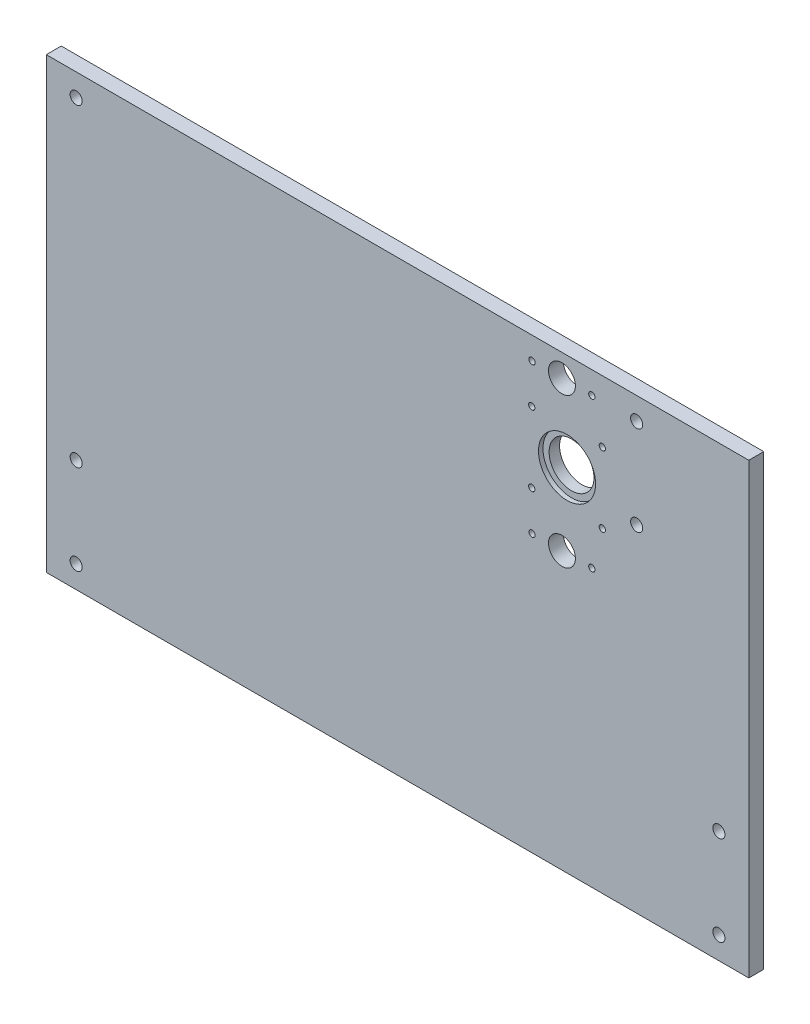
from build123d import *

# Parameters (mm, degrees)
SKETCH2_W           = 470
SKETCH2_H           = 300
BOSS_EXTRUDE1_DEPTH = 5
SKETCH3_R           = 4.05
CUT_EXTRUDE1_DEPTH  = 10
SKETCH4_R           = 9
SKETCH4_R_2         = 2.1
CUT_EXTRUDE2_DEPTH  = 279.971324691
SKETCH5_R           = 4.05
CUT_EXTRUDE3_DEPTH  = 279.971324691
SKETCH6_R           = 4.05
CUT_EXTRUDE4_DEPTH  = 279.971324691
SKETCH7_R           = 19.1
CUT_EXTRUDE5_DEPTH  = 3
SKETCH8_R           = 15
CUT_EXTRUDE6_DEPTH  = 279.879902467
SKETCH9_R           = 2.1
CUT_EXTRUDE7_DEPTH  = 279.971324691


with BuildPart() as part:
    # Sketch2 → Boss-Extrude1 (new, symmetric)
    with BuildSketch(Plane.XY):
        Rectangle(SKETCH2_W, SKETCH2_H)
    extrude(amount=BOSS_EXTRUDE1_DEPTH, both=True)

    # Sketch3 → Cut-Extrude1 (cut)
    with BuildSketch(Plane.XY.offset(5)):
        with Locations((-215, -75)):
            Circle(SKETCH3_R)
        with Locations((-215, -135)):
            Circle(SKETCH3_R)
        with Locations((215, -75)):
            Circle(SKETCH3_R)
        with Locations((215, -135)):
            Circle(SKETCH3_R)
    extrude(amount=-CUT_EXTRUDE1_DEPTH, mode=Mode.SUBTRACT)

    # Sketch4 → Cut-Extrude2 (cut, through all)
    with BuildSketch(Plane.XY.offset(5)):
        with Locations((110, 135)):
            Circle(SKETCH4_R)
        with Locations((110, 35)):
            Circle(SKETCH4_R)
        with Locations((90, 135)):
            Circle(SKETCH4_R_2)
        with Locations((130, 135)):
            Circle(SKETCH4_R_2)
        with Locations((130, 35)):
            Circle(SKETCH4_R_2)
        with Locations((90, 35)):
            Circle(SKETCH4_R_2)
    extrude(amount=-CUT_EXTRUDE2_DEPTH, mode=Mode.SUBTRACT)

    # Sketch5 → Cut-Extrude3 (cut, through all)
    with BuildSketch(Plane.XY.offset(5)):
        with Locations((160, 135)):
            Circle(SKETCH5_R)
        with Locations((160, 75)):
            Circle(SKETCH5_R)
    extrude(amount=-CUT_EXTRUDE3_DEPTH, mode=Mode.SUBTRACT)

    # Sketch6 → Cut-Extrude4 (cut, through all)
    with BuildSketch(Plane.XY.offset(5)):
        with Locations((-215, 135)):
            Circle(SKETCH6_R)
    extrude(amount=-CUT_EXTRUDE4_DEPTH, mode=Mode.SUBTRACT)

    # Sketch7 → Cut-Extrude5 (cut)
    with BuildSketch(Plane.XY.offset(5)):
        with Locations((113.4, 85)):
            Circle(SKETCH7_R)
    extrude(amount=-CUT_EXTRUDE5_DEPTH, mode=Mode.SUBTRACT)

    # Sketch8 → Cut-Extrude6 (cut, through all)
    with BuildSketch(Plane.XY.offset(2)):
        with Locations((113.4, 85)):
            Circle(SKETCH8_R)
    extrude(amount=-CUT_EXTRUDE6_DEPTH, mode=Mode.SUBTRACT)

    # Sketch9 → Cut-Extrude7 (cut, through all)
    with BuildSketch(Plane.XY.offset(5)):
        with Locations((89.8, 108.6)):
            Circle(SKETCH9_R)
        with Locations((137, 108.6)):
            Circle(SKETCH9_R)
        with Locations((137, 61.4)):
            Circle(SKETCH9_R)
        with Locations((89.8, 61.4)):
            Circle(SKETCH9_R)
    extrude(amount=-CUT_EXTRUDE7_DEPTH, mode=Mode.SUBTRACT)


solid = part.part
